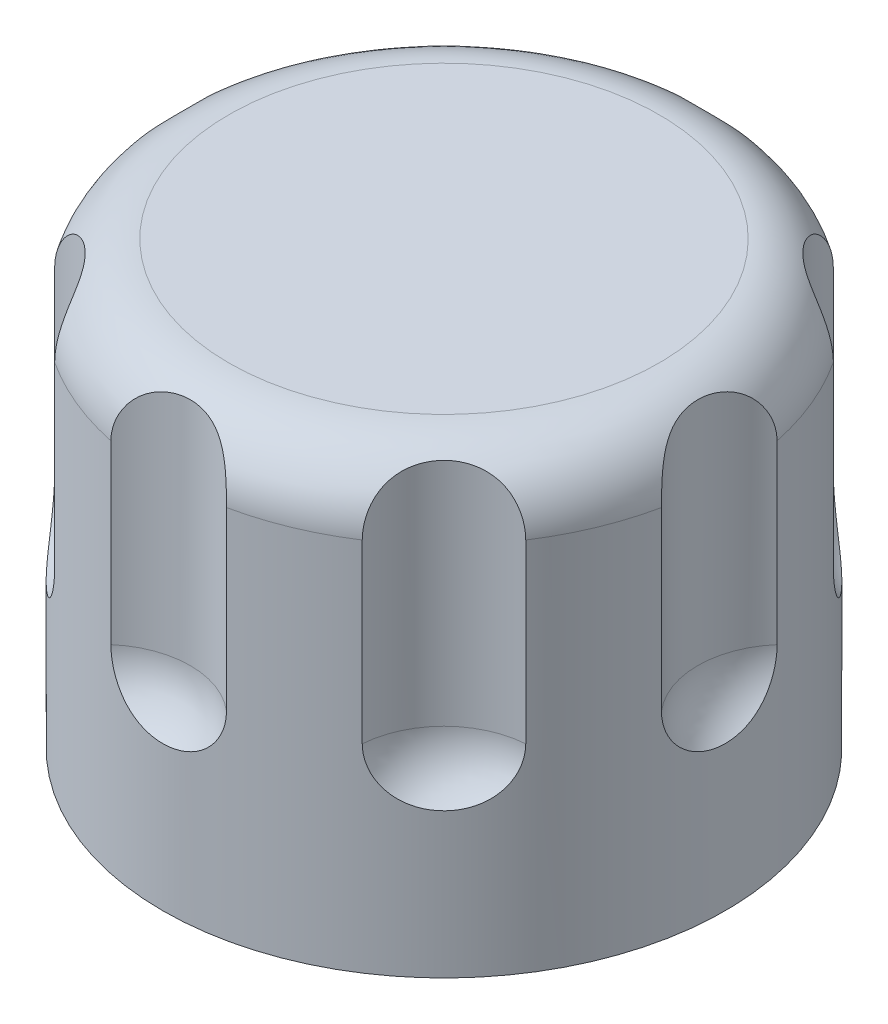
from build123d import *

# Parameters (mm, degrees)
SKETCH1_R               = 12.75
BOSS_EXTRUDE1_DEPTH     = 20
CUT_EXTRUDE1_DEPTH      = 27.928145127
CUT_EXTRUDE1_DEPTH_BACK = 18.3
SKETCH2_R               = 3.05
SKETCH3_R               = 3.5
CUT_EXTRUDE2_DEPTH      = 6
FILLET1_R               = 3
SKETCH5_R               = 4
CUT_EXTRUDE3_DEPTH      = 14
FILLET3_R               = 3
BOSS_EXTRUDE2_START     = 10
BOSS_EXTRUDE2_DEPTH     = 10


with BuildPart() as part:
    # Sketch1 → Boss-Extrude1 (new body)
    with BuildSketch(Plane(origin=(0, 0, 0), x_dir=(1, 0, 0), z_dir=(0, 1, 0))):
        with Locations(Location((0, 0, 0), (0, 0, 270))):
            Circle(SKETCH1_R)
    extrude(amount=BOSS_EXTRUDE1_DEPTH)

    # Sketch2 → Cut-Extrude1 (cut, two sides: drawn at the far end of the back side and taken through both)
    with BuildSketch(Plane.XZ.offset(-CUT_EXTRUDE1_DEPTH_BACK)):
        with Locations(Location((0, 0, 0), (0, 0, 90))):
            Circle(SKETCH2_R)
    extrude(amount=CUT_EXTRUDE1_DEPTH + CUT_EXTRUDE1_DEPTH_BACK, mode=Mode.SUBTRACT)

    # Sketch3 → Cut-Extrude2 (cut)
    with BuildSketch(Plane.XZ):
        with Locations(Location((0, 0, 0), (0, 0, 270))):
            Circle(SKETCH3_R)
    extrude(amount=-CUT_EXTRUDE2_DEPTH, mode=Mode.SUBTRACT)

    # Fillet1
    fillet1_edges = [part.edges().sort_by_distance(p)[0] for p in [
        (0, 20, -12.75),
    ]]
    fillet(fillet1_edges, radius=FILLET1_R)

    # Sketch5 → Cut-Extrude3 (cut)
    with BuildSketch(Plane(origin=(0, 20, 0), x_dir=(1, 0, 0), z_dir=(0, 1, 0))):
        with Locations((0, 15.5)):
            Circle(SKETCH5_R)
        with Locations((10.960155108, 10.960155108)):
            Circle(SKETCH5_R)
        with Locations((15.5, 0)):
            Circle(SKETCH5_R)
        with Locations((10.960155108, -10.960155108)):
            Circle(SKETCH5_R)
        with Locations((0, -15.5)):
            Circle(SKETCH5_R)
        with Locations((-10.960155108, -10.960155108)):
            Circle(SKETCH5_R)
        with Locations((-15.5, 0)):
            Circle(SKETCH5_R)
        with Locations((-10.960155108, 10.960155108)):
            Circle(SKETCH5_R)
    extrude(amount=-CUT_EXTRUDE3_DEPTH, mode=Mode.SUBTRACT)

    # Fillet3
    # the kernel refuses this fillet: 3 mm, written as the material it adds along each edge
    with BuildSketch(Plane(origin=(0, 6, 15.5), x_dir=(0.5240999982324142, 0, 0.8516567335803691), z_dir=(-0.8516567335803691, 0, 0.5240999982324142))) as fillet3_piece_1_section:
        with BuildLine():
            CenterArc((4 - FILLET3_R, FILLET3_R), FILLET3_R, 270, 90)
            Line((4 - FILLET3_R, 0), (4, 0))
            Line((4, 0), (4, FILLET3_R))
        make_face()
    fillet3_piece_1 = revolve(axis=Axis((0, 6, 15.5), (0, 1, 0)), revolution_arc=296.784649365, mode=Mode.PRIVATE)
    fillet3_piece_1 = fillet3_piece_1 & Plane(origin=(0, 6.906503108, 0), x_dir=(0, 0, 1), z_dir=(0, -1, 0)) * Cylinder(12.75, 17, mode=Mode.PRIVATE)
    add(fillet3_piece_1)
    with BuildSketch(Plane(origin=(-10.960155108, 6, 10.960155108), x_dir=(-0.2316175887878651, 0, 0.9728069143278617), z_dir=(-0.9728069143278617, 0, -0.2316175887878651))) as fillet3_piece_2_section:
        with BuildLine():
            CenterArc((4 - FILLET3_R, FILLET3_R), FILLET3_R, 270, 90)
            Line((4, FILLET3_R), (4, 0))
            Line((4, 0), (4 - FILLET3_R, 0))
        make_face()
    fillet3_piece_2 = revolve(axis=Axis((-10.960155108, 6, 10.960155108), (0, 1, 0)), revolution_arc=296.784649365, mode=Mode.PRIVATE)
    fillet3_piece_2 = fillet3_piece_2 & Plane(origin=(0, 6.906501973, 0), x_dir=(0, 0, 1), z_dir=(0, -1, 0)) * Cylinder(12.75, 16, mode=Mode.PRIVATE)
    add(fillet3_piece_2)
    with BuildSketch(Plane(origin=(-15.5, 6, 0), x_dir=(-0.8516567335803689, 0, -0.524099998232414), z_dir=(-0.524099998232414, 0, 0.8516567335803689))) as fillet3_piece_3_section:
        with BuildLine():
            CenterArc((4 - FILLET3_R, -FILLET3_R), FILLET3_R, 0, 90)
            Line((4, -FILLET3_R), (4, 0))
            Line((4, 0), (4 - FILLET3_R, 0))
        make_face()
    fillet3_piece_3 = revolve(axis=Axis((-15.5, 6, 0), (0, -1, 0)), revolution_arc=296.784649365, mode=Mode.PRIVATE)
    fillet3_piece_3 = fillet3_piece_3 & Plane(origin=(0, 6.90650195, 0), x_dir=(0, 0, 1), z_dir=(0, -1, 0)) * Cylinder(12.75, 16, mode=Mode.PRIVATE)
    add(fillet3_piece_3)
    with BuildSketch(Plane(origin=(-10.960155108, 6, -10.960155108), x_dir=(-0.9728069143278615, 0, -0.23161758878786548), z_dir=(0.23161758878786548, 0, -0.9728069143278615))) as fillet3_piece_4_section:
        with BuildLine():
            CenterArc((4 - FILLET3_R, FILLET3_R), FILLET3_R, 270, 90)
            Line((4, FILLET3_R), (4, 0))
            Line((4, 0), (4 - FILLET3_R, 0))
        make_face()
    fillet3_piece_4 = revolve(axis=Axis((-10.960155108, 6, -10.960155108), (0, 1, 0)), revolution_arc=296.784649365, mode=Mode.PRIVATE)
    fillet3_piece_4 = fillet3_piece_4 & Plane(origin=(0, 6.906501973, 0), x_dir=(0, 0, 1), z_dir=(0, -1, 0)) * Cylinder(12.75, 17, mode=Mode.PRIVATE)
    add(fillet3_piece_4)
    with BuildSketch(Plane(origin=(0, 6, -15.5), x_dir=(-0.5240999982324135, 0, -0.8516567335803694), z_dir=(0.8516567335803694, 0, -0.5240999982324135))) as fillet3_piece_5_section:
        with BuildLine():
            CenterArc((4 - FILLET3_R, FILLET3_R), FILLET3_R, 270, 90)
            Line((4, FILLET3_R), (4, 0))
            Line((4, 0), (4 - FILLET3_R, 0))
        make_face()
    fillet3_piece_5 = revolve(axis=Axis((0, 6, -15.5), (0, 1, 0)), revolution_arc=296.784649365, mode=Mode.PRIVATE)
    fillet3_piece_5 = fillet3_piece_5 & Plane(origin=(0, 6.906501973, 0), x_dir=(0, 0, 1), z_dir=(0, -1, 0)) * Cylinder(12.75, 16, mode=Mode.PRIVATE)
    add(fillet3_piece_5)
    with BuildSketch(Plane(origin=(10.960155108, 6, -10.960155108), x_dir=(0.2316175887878651, 0, -0.9728069143278617), z_dir=(0.9728069143278617, 0, 0.2316175887878651))) as fillet3_piece_6_section:
        with BuildLine():
            CenterArc((4 - FILLET3_R, FILLET3_R), FILLET3_R, 270, 90)
            Line((4, FILLET3_R), (4, 0))
            Line((4, 0), (4 - FILLET3_R, 0))
        make_face()
    fillet3_piece_6 = revolve(axis=Axis((10.960155108, 6, -10.960155108), (0, 1, 0)), revolution_arc=296.784649365, mode=Mode.PRIVATE)
    fillet3_piece_6 = fillet3_piece_6 & Plane(origin=(0, 6.906501973, 0), x_dir=(0, 0, 1), z_dir=(0, -1, 0)) * Cylinder(12.75, 16, mode=Mode.PRIVATE)
    add(fillet3_piece_6)
    with BuildSketch(Plane(origin=(15.5, 6, 0), x_dir=(0.8516567335803694, 0, -0.5240999982324135), z_dir=(0.5240999982324135, 0, 0.8516567335803694))) as fillet3_piece_7_section:
        with BuildLine():
            CenterArc((4 - FILLET3_R, FILLET3_R), FILLET3_R, 270, 90)
            Line((4, FILLET3_R), (4, 0))
            Line((4, 0), (4 - FILLET3_R, 0))
        make_face()
    fillet3_piece_7 = revolve(axis=Axis((15.5, 6, 0), (0, 1, 0)), revolution_arc=296.784649365, mode=Mode.PRIVATE)
    fillet3_piece_7 = fillet3_piece_7 & Plane(origin=(0, 6.906501973, 0), x_dir=(0, 0, 1), z_dir=(0, -1, 0)) * Cylinder(12.75, 17, mode=Mode.PRIVATE)
    add(fillet3_piece_7)
    with BuildSketch(Plane(origin=(10.960155108, 6, 10.960155108), x_dir=(0.9728069143278617, 0, 0.2316175887878651), z_dir=(-0.2316175887878651, 0, 0.9728069143278617))) as fillet3_piece_8_section:
        with BuildLine():
            CenterArc((4 - FILLET3_R, FILLET3_R), FILLET3_R, 270, 90)
            Line((4, FILLET3_R), (4, 0))
            Line((4, 0), (4 - FILLET3_R, 0))
        make_face()
    fillet3_piece_8 = revolve(axis=Axis((10.960155108, 6, 10.960155108), (0, 1, 0)), revolution_arc=296.784649365, mode=Mode.PRIVATE)
    fillet3_piece_8 = fillet3_piece_8 & Plane(origin=(0, 6.906501973, 0), x_dir=(0, 0, 1), z_dir=(0, -1, 0)) * Cylinder(12.75, 16, mode=Mode.PRIVATE)
    add(fillet3_piece_8)

    # Sketch6 → Boss-Extrude2 (add)
    with BuildSketch(Plane.XZ.offset(-18.3).offset(BOSS_EXTRUDE2_START)):
        with BuildLine():
            Line((1.6, 2.596632435), (1.6, -2.596632435))
            ThreePointArc((1.6, -2.596632435), (3.05, 0), (1.6, 2.596632435))
        make_face()
    extrude(amount=-BOSS_EXTRUDE2_DEPTH)


solid = part.part
